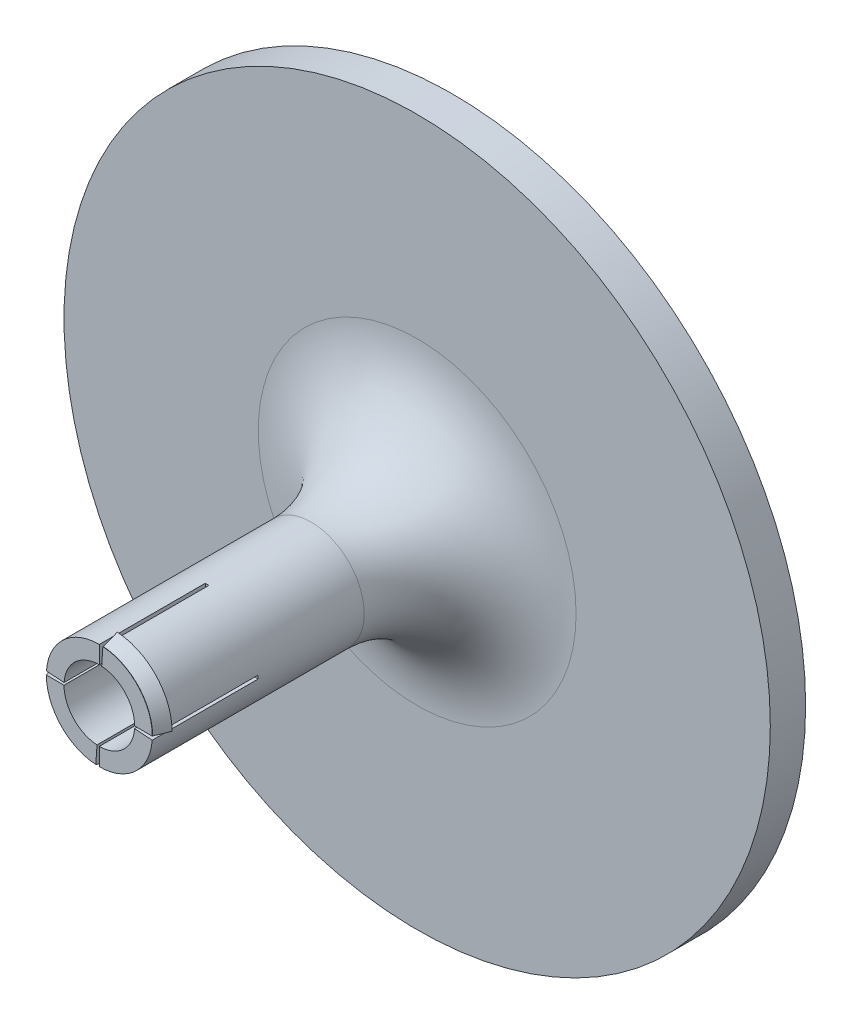
from build123d import *

# Parameters (mm, degrees)
SKETCH_3_R               = 5
CUT_EXTRUDE_1_DEPTH      = 87.602540378
CUT_EXTRUDE_2_DEPTH      = 15
PATTERN_CIRCULAR_1_COUNT = 4
PATTERN_CIRCULAR_2_COUNT = 2


with BuildPart() as part:
    # 扫描1: sweep along a path in 草图2
    with BuildLine(Plane.XY) as sweep_1_path:
        CenterArc((0, 0), 50, 0, 360)
    # 草图1 → 扫描1 (sweep)
    with BuildSketch(Plane(origin=(0, 0, 0), x_dir=(1, 0, 0), z_dir=(0, 1, 0))):
        with BuildLine():
            Line((0, 0), (7.5, 0))
            Line((7.5, 0), (7.5, 30))
            ThreePointArc((7.5, 30), (11.893398282, 40.606601718), (22.5, 45))
            Line((22.5, 45), (50, 45))
            Line((50, 45), (50, 50))
            Line((50, 50), (0, 50))
            Line((0, 50), (0, 0))
        make_face()
    sweep(path=sweep_1_path.line)

    # 草图3 → 切除-拉伸1 (cut, through all)
    with BuildSketch(Plane.XY):
        Circle(SKETCH_3_R)
    extrude(amount=-CUT_EXTRUDE_1_DEPTH, mode=Mode.SUBTRACT)

    # 草图5 → 切除-拉伸2 (cut)
    with BuildSketch(Plane.XY):
        Polygon((0, 7.5), (0.5, 7.5), (0, 0), align=None)
    cut_extrude_2 = extrude(amount=-CUT_EXTRUDE_2_DEPTH, mode=Mode.SUBTRACT)

    # 阵列(圆周)1: 切除-拉伸2 ×4 about axis
    pattern_circular_1_axis = Axis((0, 0, 0), (0, 0, 1))
    for i in range(1, PATTERN_CIRCULAR_1_COUNT):
        add(cut_extrude_2.rotate(pattern_circular_1_axis, i * 360 / PATTERN_CIRCULAR_1_COUNT), mode=Mode.SUBTRACT)

    # 扫描2: sweep along a curve in space
    with BuildLine() as sweep_2_path:
        ThreePointArc((7.5, 0, 0), (5.476846462, 5.123880642, 0), (0.498892579, 7.483388684, 0))
    # 草图10 → 扫描2 (sweep)
    with BuildSketch(Plane(origin=(0, 0, 0), x_dir=(0, 0, 1), z_dir=(-0.997785157856609, 0.06651901052377394, 0))):
        Polygon((0, 7.483388684), (-1.999931015, 7.5), (-1.999931015, 8.3), align=None)
    sweep_2 = sweep(path=sweep_2_path.line)

    # 阵列(圆周)2: 扫描2 ×2 about axis
    pattern_circular_2_axis = Axis((0, 0, 0), (0, 0, 1))
    for i in range(1, PATTERN_CIRCULAR_2_COUNT):
        add(sweep_2.rotate(pattern_circular_2_axis, i * 360 / PATTERN_CIRCULAR_2_COUNT))


solid = part.part
